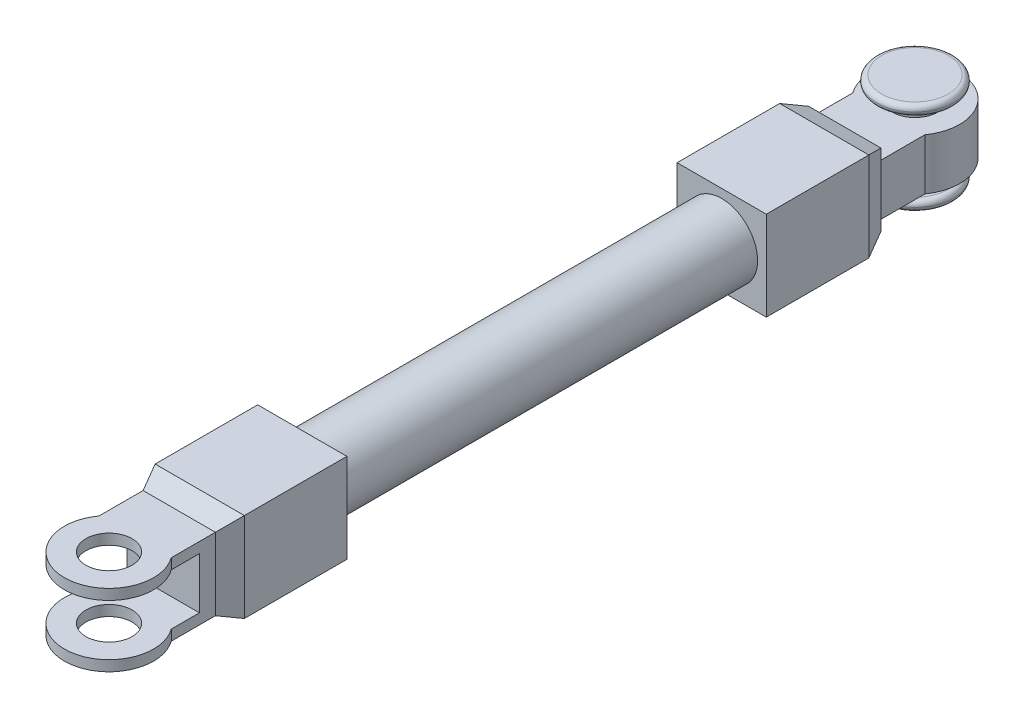
from build123d import *

# Parameters (mm, degrees)
SKETCH2_R                = 70
BOSS_EXTRUDE2_DEPTH      = 1018
SKETCH4_W                = 174
SKETCH4_H                = 174
BOSS_EXTRUDE3_DEPTH      = 100
SKETCH7_W                = 174
SKETCH7_H                = 174
BOSS_EXTRUDE4_DEPTH      = 100
SKETCH14_R               = 87
BOSS_EXTRUDE5_DEPTH      = 141
SKETCH16_R               = 45
CUT_EXTRUDE1_DEPTH       = 141
BOSS_EXTRUDE6_REACH      = 1305.818
BOSS_EXTRUDE6_END_RADIUS = 87
SKETCH17_W               = 141
SKETCH17_H               = 141
SKETCH23_W               = 196.221845396
SKETCH23_H               = 100
CUT_EXTRUDE2_DEPTH       = 201
BOSS_EXTRUDE7_DEPTH      = 50
SKETCH26_R               = 45
BOSS_EXTRUDE8_DEPTH      = 20.5
SKETCH27_R               = 45
BOSS_EXTRUDE9_DEPTH      = 20.5
SKETCH28_R               = 75
BOSS_EXTRUDE10_DEPTH     = 20
FILLET1_R                = 10
SKETCH29_R               = 75
BOSS_EXTRUDE11_DEPTH     = 20
FILLET2_R                = 10


with BuildPart() as part:
    # Sketch2 → Boss-Extrude2 (new body)
    with BuildSketch(Plane.XY):
        Circle(SKETCH2_R)
    extrude(amount=-BOSS_EXTRUDE2_DEPTH)

    # Sketch4 → Boss-Extrude3 (add, symmetric)
    with BuildSketch(Plane.XY):
        Rectangle(SKETCH4_W, SKETCH4_H)
    extrude(amount=BOSS_EXTRUDE3_DEPTH, both=True)

    # Sketch7 → Boss-Extrude4 (add, symmetric)
    with BuildSketch(Plane(origin=(0, 0, -1018), x_dir=(-1, 0, 0), z_dir=(0, 0, -1))):
        Rectangle(SKETCH7_W, SKETCH7_H)
    extrude(amount=BOSS_EXTRUDE4_DEPTH, both=True)

    # Sketch8 → section 1 of loft1
    with BuildSketch(Plane.XY.offset(140), mode=Mode.PRIVATE) as loft1_s1:
        with BuildLine():
            Line((-70.5, 70.5), (70.5, 70.5))
            Line((70.5, 70.5), (70.5, -70.5))
            Line((70.5, -70.5), (-70.5, -70.5))
            Line((-70.5, -70.5), (-70.5, 70.5))
        make_face()
    # loft from a face of the part (loft1)
    loft([part.faces().sort_by_distance((0, 0, 100))[0], loft1_s1.sketch])

    # Sketch10 → section 1 of loft8
    with BuildSketch(Plane(origin=(0, 0, -1158), x_dir=(-1, 0, 0), z_dir=(0, 0, -1)), mode=Mode.PRIVATE) as loft8_s1:
        with BuildLine():
            Line((-70.5, 70.5), (70.5, 70.5))
            Line((70.5, 70.5), (70.5, -70.5))
            Line((70.5, -70.5), (-70.5, -70.5))
            Line((-70.5, -70.5), (-70.5, 70.5))
        make_face()
    # loft from a face of the part (loft8)
    loft([part.faces().sort_by_distance((0, 0, -1118))[0], loft8_s1.sketch])



with BuildPart() as body_2:
    # Sketch14 → Boss-Extrude5 (new body)
    with BuildSketch(Plane(origin=(0, 70.5, 0), x_dir=(-1, 0, 0), z_dir=(0, 1, 0))):
        with Locations(Location((0, 277, 0), (0, 0, 90))):
            Circle(SKETCH14_R)
    extrude(amount=-BOSS_EXTRUDE5_DEPTH)

    # Sketch16 → Cut-Extrude1 (cut)
    with BuildSketch(Plane(origin=(0, 70.5, 0), x_dir=(1, 0, 0), z_dir=(0, 1, 0))):
        with Locations(Location((0, -277, 0), (0, 0, 270))):
            Circle(SKETCH16_R)
    extrude(amount=-CUT_EXTRUDE1_DEPTH, mode=Mode.SUBTRACT)


with BuildPart() as part_1:
    add(part.part)

    add(body_2.part)  # Boss-Extrude6 merges body 2
    # Boss-Extrude6: up to this cylinder (the profile starts outside it)
    boss_extrude6_end = Plane(origin=(0, 0, 277), z_dir=(0, 1, 0)) * Cylinder(BOSS_EXTRUDE6_END_RADIUS, 2786.636, mode=Mode.PRIVATE)
    # Sketch17 → Boss-Extrude6 (add, up to the surface)
    with BuildSketch(Plane.XY.offset(140), mode=Mode.PRIVATE) as boss_extrude6_sk1:
        Rectangle(SKETCH17_W, SKETCH17_H)
    boss_extrude6_tool1 = extrude(boss_extrude6_sk1.sketch, amount=BOSS_EXTRUDE6_REACH, mode=Mode.PRIVATE) - boss_extrude6_end
    add(boss_extrude6_tool1.solids().sort_by_distance((0, 0, 140))[0])

    # Sketch23 → Cut-Extrude2 (cut)
    with BuildSketch(Plane.ZY.offset(94.5)):
        with Locations((269.287462291, 0)):
            Rectangle(SKETCH23_W, SKETCH23_H)
    extrude(amount=-CUT_EXTRUDE2_DEPTH, mode=Mode.SUBTRACT)


with BuildPart() as body_2_2:
    # Sketch24 → Boss-Extrude7 (new, symmetric)
    with BuildSketch(Plane(origin=(0, 0, 0), x_dir=(1, 0, 0), z_dir=(0, 1, 0))):
        with BuildLine():
            Line((-70.5, 1158), (70.5, 1158))
            Line((70.5, 1158), (70.5, 1244.022063596))
            ThreePointArc((70.5, 1244.022063596), (0, 1382), (-70.5, 1244.022063596))
            Line((-70.5, 1244.022063596), (-70.5, 1158))
        make_face()
    extrude(amount=BOSS_EXTRUDE7_DEPTH, both=True)

    # Sketch26 → Boss-Extrude8 (add)
    with BuildSketch(Plane(origin=(0, 50, 0), x_dir=(1, 0, 0), z_dir=(0, 1, 0))):
        with Locations(Location((0, 1295, 0), (0, 0, 270))):
            Circle(SKETCH26_R)
    extrude(amount=BOSS_EXTRUDE8_DEPTH)

    # Sketch27 → Boss-Extrude9 (add)
    with BuildSketch(Plane.XZ.offset(50)):
        with Locations(Location((0, -1295, 0), (0, 0, 90))):
            Circle(SKETCH27_R)
    extrude(amount=BOSS_EXTRUDE9_DEPTH)

    # Sketch28 → Boss-Extrude10 (add)
    with BuildSketch(Plane.XZ.offset(70.5)):
        with Locations(Location((0, -1295, 0), (0, 0, 270))):
            Circle(SKETCH28_R)
    extrude(amount=BOSS_EXTRUDE10_DEPTH)

    # Fillet1
    fillet1_edges = [body_2_2.edges().sort_by_distance(p)[0] for p in [
        (0, -70.5, -1220),
        (0, -90.5, -1220),
    ]]
    fillet(fillet1_edges, radius=FILLET1_R - 0.0001)  # a hair under: the kernel refuses the full size

    # Sketch29 → Boss-Extrude11 (add)
    with BuildSketch(Plane(origin=(0, 70.5, 0), x_dir=(1, 0, 0), z_dir=(0, 1, 0))):
        with Locations(Location((0, 1295, 0), (0, 0, 270))):
            Circle(SKETCH29_R)
    extrude(amount=BOSS_EXTRUDE11_DEPTH)

    # Fillet2
    fillet2_edges = [body_2_2.edges().sort_by_distance(p)[0] for p in [
        (0, 70.5, -1370),
        (0, 90.5, -1370),
    ]]
    fillet(fillet2_edges, radius=FILLET2_R - 0.0001)  # a hair under: the kernel refuses the full size


solid = Compound([part_1.part, body_2_2.part])
